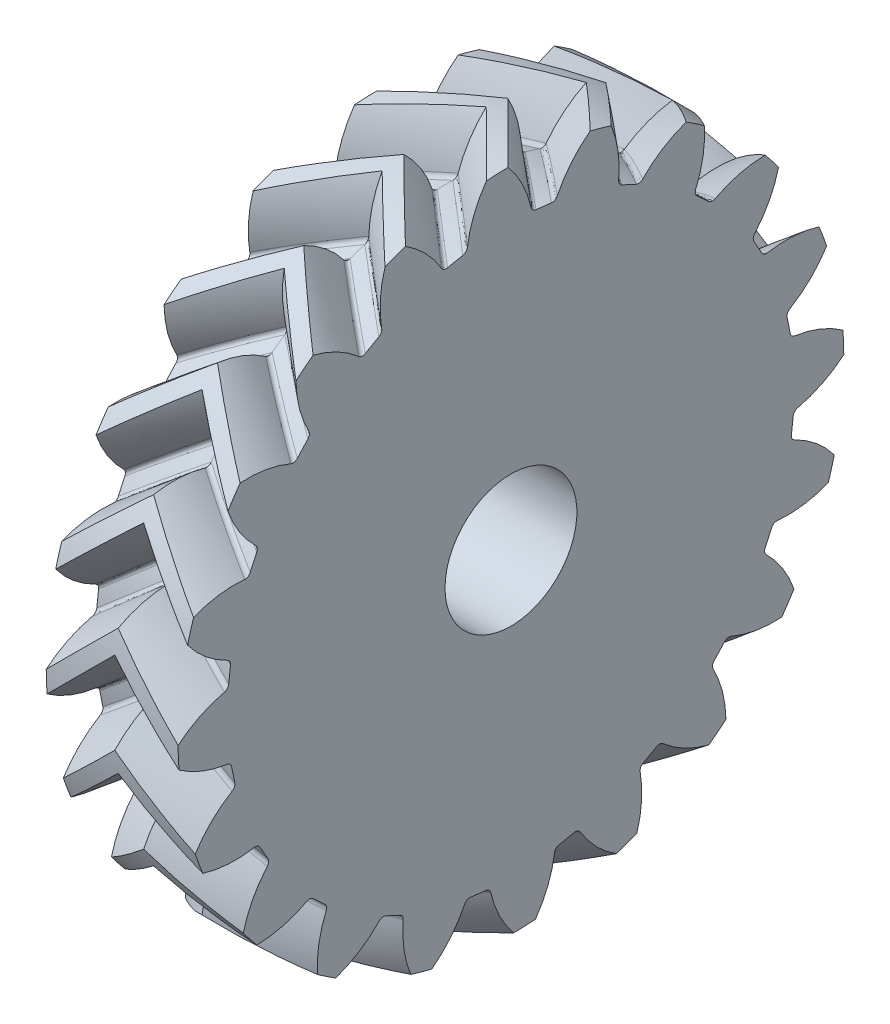
from build123d import *

# Parameters (mm, degrees)
BASPROSKE_W            = 3
BASPROSKE_H            = 15.142135624
TOOTHCUTRH_PITCH       = 95.14084407
TOOTHCUTRH_HEIGHT      = 3
TOOTHCUTRH_RADIUS      = 15.142135624
TOOTHCUTRH_START_ANGLE = -90
TEETHCUTSRH_COUNT      = 20
TEETHCUTSRH_ANGLE      = 342
BORSKE_R               = 3
BORE_DEPTH             = 62.5000025


with BuildPart() as part:
    # BasProSke → Base-Revolve (revolve)
    with BuildSketch(Plane(origin=(0, 0, 0), x_dir=(1, 0, 0), z_dir=(0, 1, 0)), mode=Mode.PRIVATE) as base_revolve_sk:
        with Locations((1.5, 7.571067812)):
            Rectangle(BASPROSKE_W, BASPROSKE_H)
    revolve(base_revolve_sk.sketch.rotate(Axis((-10, 0, 0), (1, 0, 0)), 180), axis=Axis((-10, 0, 0), (1, 0, 0)))

    # ToothCutRH: sweep along a helix
    with BuildLine() as toothcutrh_path:
        add(Helix(TOOTHCUTRH_PITCH, TOOTHCUTRH_HEIGHT, TOOTHCUTRH_RADIUS, center=(0, 0, 0), direction=(1, 0, 0), mode=Mode.PRIVATE).rotate(Axis((0, 0, 0), (1, 0, 0)), TOOTHCUTRH_START_ANGLE))
    # TooCutSkeRH → ToothCutRH (sweep, cut)
    with BuildSketch(Plane(origin=(0, 0, 0), x_dir=(0, 0, -1), z_dir=(1, 0, 0))):
        with BuildLine():
            ThreePointArc((0.354507116, 12.887260595), (0, 12.892135624), (-0.354507116, 12.887260595))
            ThreePointArc((-0.354507116, 12.887260595), (-0.503656114, 12.931364361), (-0.598186363, 13.054873866))
            ThreePointArc((-0.598186363, 13.054873866), (-1.294466274, 14.368281691), (-2.346124634, 15.418929359))
            ThreePointArc((-2.346124634, 15.418929359), (0, 15.596399692), (2.346124634, 15.418929359))
            ThreePointArc((2.346124634, 15.418929359), (1.294466274, 14.368281691), (0.598186363, 13.054873866))
            ThreePointArc((0.598186363, 13.054873866), (0.503656114, 12.931364361), (0.354507116, 12.887260595))
        make_face()
    toothcutrh = sweep(path=toothcutrh_path.line, is_frenet=True, mode=Mode.SUBTRACT)

    # TeethCutsRH: ToothCutRH ×20 about axis
    teethcutsrh_axis = Axis((-10, 0, 0), (1, 0, 0))
    for i in range(1, TEETHCUTSRH_COUNT):
        add(toothcutrh.rotate(teethcutsrh_axis, i * TEETHCUTSRH_ANGLE / (TEETHCUTSRH_COUNT - 1)), mode=Mode.SUBTRACT)

    # BorSke → Bore (cut, symmetric)
    with BuildSketch(Plane(origin=(0, 0, 0), x_dir=(0, 0, -1), z_dir=(1, 0, 0))):
        with Locations(Location((0, 0, 0), (0, 0, 180))):
            Circle(BORSKE_R)
    extrude(amount=BORE_DEPTH, both=True, mode=Mode.SUBTRACT)

    # Mirror1: part across plane


with BuildPart() as part_1:
    add(part.part)
    add(part.part.mirror(Plane(origin=(0, 0, 0), x_dir=(0, 0, 1), z_dir=(1, 0, 0))))


solid = part_1.part
